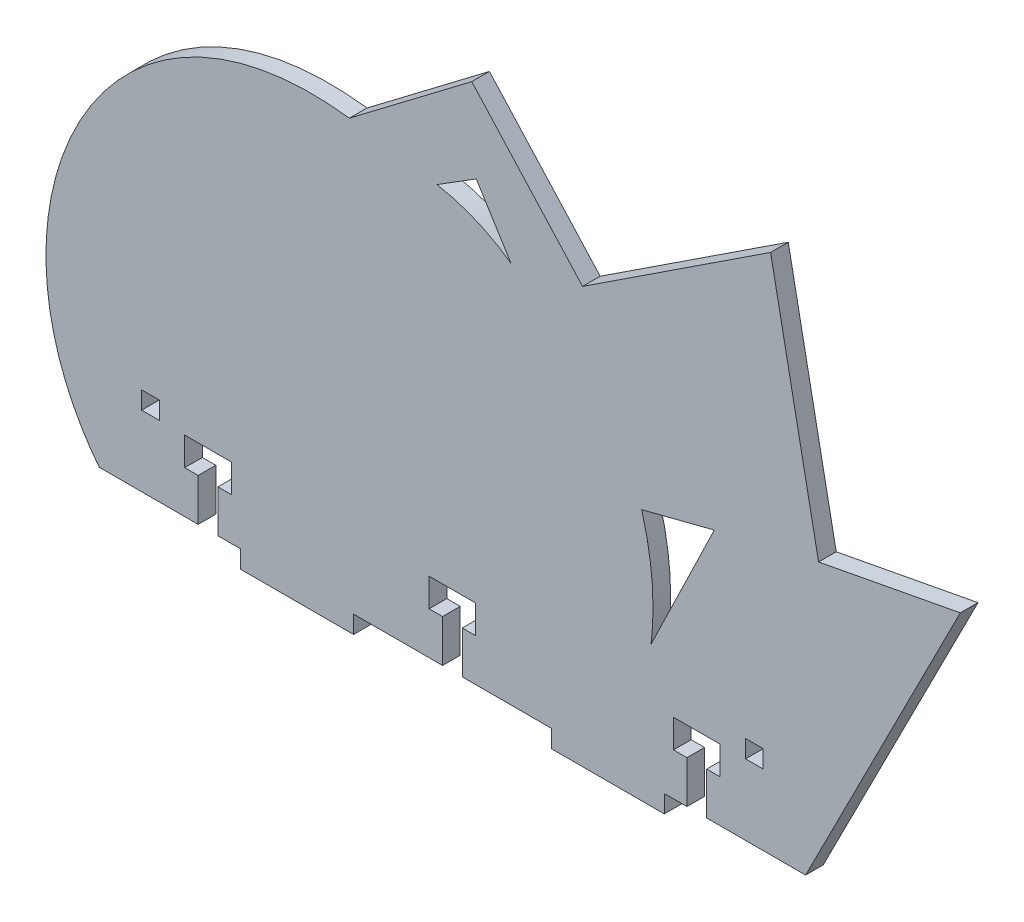
from build123d import *

# Parameters (mm, degrees)
BOSS_EXTRUDE2_DEPTH = 6.35
SCALE1_DEPTH        = 6.35
SCALE1_2_DEPTH      = 1.587500269
SCALE1_START        = 4.762500269
SCALE1_3_DEPTH      = 1.587499731
SCALE1_START_2      = 1.587500269
SCALE1_4_DEPTH      = 3.175
SKETCH2_W           = 3.175
SKETCH2_H           = 3.175
CUT_EXTRUDE2_DEPTH  = 3.175
SKETCH3_W           = 20.32
SKETCH3_H           = 3.175
BOSS_EXTRUDE3_DEPTH = 3.175
CUT_EXTRUDE3_DEPTH  = 3.175


# Read off the part's stored shape, not the designer's step: Scale1
with BuildPart() as part:
    # Sketch1 → Boss-Extrude2 (new body)
    with BuildSketch(Plane.XY):
        with BuildLine():
            Line((83.827808052, -44.105116896), (-89.955824252, -44.105116896))
            add(Edge.make_bspline(
                [(-89.955824252, -44.105116896), (-138.279146298, 17.577773588), (-90.448185334, 121.033367978), (0, 109.592549188)],
                knots=[0, 0, 0, 0, 1, 1, 1, 1], degree=3))
            Line((0, 109.592549188), (44.001127073, 142.976601592))
            Line((44.001127073, 142.976601592), (83.827808052, 99.113432677))
            Line((83.827808052, 99.113432677), (151.46035168, 143.51342315))
            Line((151.46035168, 143.51342315), (168.705700605, 55.742873106))
            Line((168.705700605, 55.742873106), (219.688100022, 65.389167163))
            Line((219.688100022, 65.389167163), (164.044175748, -44.105116896))
            Line((164.044175748, -44.105116896), (83.827808052, -44.105116896))
        make_face()
        with BuildLine():
            Line((108.479325939, 0.038399309), (131.217832103, 46.925099923))
            Line((131.217832103, 46.925099923), (105.101551368, 40.233461811))
            add(Edge.make_bspline(
                [(108.479325939, 0.038399309), (109.348375822, 7.243418902), (109.431703621, 20.845994783), (106.837891987, 34.226883905), (105.101551368, 40.233461811)],
                knots=[0.221169561, 0.221169561, 0.221169561, 0.221169561, 0.320684156, 0.405876818, 0.405876818, 0.405876818, 0.405876818], degree=3))
        make_face(mode=Mode.SUBTRACT)
        with BuildLine():
            Line((31.501577026, 104.663344036), (45.60523641, 113.478131151))
            Line((45.60523641, 113.478131151), (58.141193688, 93.420599506))
            add(Edge.make_bspline(
                [(58.141193688, 93.420599506), (46.052907541, 102.061530026), (31.501577026, 104.663344036)],
                knots=[0, 0, 0, 1, 1, 1], degree=2))
        make_face(mode=Mode.SUBTRACT)
    extrude(amount=BOSS_EXTRUDE2_DEPTH)

    # Scale1 outline → Scale1 (cut)
    # profile 1 of 3: a face of its own
    with BuildSketch(Plane.XY):
        with BuildLine():
            Line((44.001127073, 142.976601592), (0, 109.592549188))
            add(Edge.make_bspline(
                [(0, 109.592549188), (-90.448185334, 121.033367978), (-138.279146298, 17.577773588), (-89.955824252, -44.105116896)],
                knots=[0, 0, 0, 0, 1, 1, 1, 1], degree=3))
            Line((-89.955824252, -44.105116896), (164.044175748, -44.105116896))
            Line((164.044175748, -44.105116896), (219.688100022, 65.389167163))
            Line((219.688100022, 65.389167163), (168.705700605, 55.742873106))
            Line((168.705700605, 55.742873106), (151.46035168, 143.51342315))
            Line((151.46035168, 143.51342315), (83.827808052, 99.113432677))
            Line((83.827808052, 99.113432677), (44.001127073, 142.976601592))
        make_face()
        with BuildLine():
            add(Edge.make_bspline(
                [(22.378427384, 71.952774895), (-22.845665283, 77.67318429), (-46.761145765, 25.945387095), (-22.599484742, -4.896058147)],
                knots=[0, 0, 0, 0, 1, 1, 1, 1], degree=3))
            Line((22.378427384, 71.952774895), (44.378990921, 88.644801097))
            Line((44.378990921, 88.644801097), (64.29233141, 66.713216639))
            Line((64.29233141, 66.713216639), (98.108603224, 88.913211876))
            Line((98.108603224, 88.913211876), (106.731277687, 45.027936854))
            Line((106.731277687, 45.027936854), (132.222477396, 49.851083882))
            Line((132.222477396, 49.851083882), (130.663317047, 46.783019429))
            Line((130.663317047, 46.783019429), (131.217832103, 46.925099923))
            Line((131.217832103, 46.925099923), (108.479325939, 0.038399309))
            add(Edge.make_bspline(
                [(108.864671926, 3.888362517), (108.762049288, 2.601843236), (108.633688525, 1.318171025), (108.479325939, 0.038399309)],
                knots=[0.388200813, 0.388200813, 0.388200813, 0.388200813, 0.405876818, 0.405876818, 0.405876818, 0.405876818], degree=3))
            Line((108.864671926, 3.888362517), (104.400515258, -4.896058147))
            Line((104.400515258, -4.896058147), (-22.599484742, -4.896058147))
        make_face(mode=Mode.SUBTRACT)
        with BuildLine():
            add(Edge.make_bspline(
                [(31.501577026, 104.663344036), (46.052907541, 102.061530026), (58.141193688, 93.420599506)],
                knots=[0, 0, 0, 1, 1, 1], degree=2))
            Line((31.501577026, 104.663344036), (45.60523641, 113.478131151))
            Line((45.60523641, 113.478131151), (58.141193688, 93.420599506))
        make_face(mode=Mode.SUBTRACT)
    # profile 2 of 3: a face of its own
    with BuildSketch(Plane.XY):
        with BuildLine():
            Line((45.18104559, 73.895565876), (38.129215897, 69.488172319))
            add(Edge.make_bspline(
                [(38.129215897, 69.488172319), (45.404881155, 68.187265314), (51.449024229, 63.866800054)],
                knots=[0, 0, 0, 1, 1, 1], degree=2))
            Line((51.449024229, 63.866800054), (45.18104559, 73.895565876))
        make_face()
    # profile 3 of 3: a face of its own
    with BuildSketch(Plane.XY):
        with BuildLine():
            Line((87.987343436, 40.619050262), (74.929203069, 37.273231206))
            add(Edge.make_bspline(
                [(74.929203069, 37.273231206), (75.797373378, 34.269942253), (77.094279195, 27.579497692), (77.052615295, 20.778209752), (76.618090354, 17.175699955)],
                knots=[0.221169561, 0.221169561, 0.221169561, 0.221169561, 0.306362223, 0.405876818, 0.405876818, 0.405876818, 0.405876818], degree=3))
            Line((76.618090354, 17.175699955), (87.987343436, 40.619050262))
        make_face()
    extrude(amount=SCALE1_DEPTH, mode=Mode.SUBTRACT)

    # Scale1 2 outline → Scale1 2 (cut)
    with BuildSketch(Plane.XY):
        with BuildLine():
            Line((44.378990921, 88.644801097), (22.378427384, 71.952774895))
            add(Edge.make_bspline(
                [(22.378427384, 71.952774895), (-22.845665283, 77.67318429), (-46.761145765, 25.945387095), (-22.599484742, -4.896058147)],
                knots=[0, 0, 0, 0, 1, 1, 1, 1], degree=3))
            Line((-22.599484742, -4.896058147), (104.400515258, -4.896058147))
            Line((104.400515258, -4.896058147), (108.864671926, 3.888362517))
            add(Edge.make_bspline(
                [(105.101551368, 40.233461811), (106.837891987, 34.226883905), (109.183482579, 22.126511148), (109.339807105, 9.844851123), (108.864671926, 3.888362517)],
                knots=[0.221169561, 0.221169561, 0.221169561, 0.221169561, 0.306362223, 0.388200813, 0.388200813, 0.388200813, 0.388200813], degree=3))
            Line((105.101551368, 40.233461811), (130.663317047, 46.783019429))
            Line((130.663317047, 46.783019429), (132.222477396, 49.851083882))
            Line((132.222477396, 49.851083882), (106.731277687, 45.027936854))
            Line((106.731277687, 45.027936854), (98.108603224, 88.913211876))
            Line((98.108603224, 88.913211876), (64.29233141, 66.713216639))
            Line((64.29233141, 66.713216639), (44.378990921, 88.644801097))
        make_face()
        with BuildLine():
            add(Edge.make_bspline(
                [(74.929203069, 37.273231206), (75.797373378, 34.269942253), (77.094279195, 27.579497692), (77.052615295, 20.778209752), (76.618090354, 17.175699955)],
                knots=[0.221169561, 0.221169561, 0.221169561, 0.221169561, 0.306362223, 0.405876818, 0.405876818, 0.405876818, 0.405876818], degree=3))
            Line((74.929203069, 37.273231206), (87.987343436, 40.619050262))
            Line((87.987343436, 40.619050262), (76.618090354, 17.175699955))
        make_face(mode=Mode.SUBTRACT)
        with BuildLine():
            add(Edge.make_bspline(
                [(38.129215897, 69.488172319), (45.404881155, 68.187265314), (51.449024229, 63.866800054)],
                knots=[0, 0, 0, 1, 1, 1], degree=2))
            Line((38.129215897, 69.488172319), (45.18104559, 73.895565876))
            Line((45.18104559, 73.895565876), (51.449024229, 63.866800054))
        make_face(mode=Mode.SUBTRACT)
    extrude(amount=SCALE1_2_DEPTH, mode=Mode.SUBTRACT)

    # Scale1 3 outline → Scale1 3 (cut)
    with BuildSketch(Plane.XY.offset(SCALE1_START)):
        with BuildLine():
            Line((44.378990921, 88.644801097), (22.378427384, 71.952774895))
            add(Edge.make_bspline(
                [(22.378427384, 71.952774895), (-22.845665283, 77.67318429), (-46.761145765, 25.945387095), (-22.599484742, -4.896058147)],
                knots=[0, 0, 0, 0, 1, 1, 1, 1], degree=3))
            Line((-22.599484742, -4.896058147), (104.400515258, -4.896058147))
            Line((104.400515258, -4.896058147), (108.864671926, 3.888362517))
            add(Edge.make_bspline(
                [(105.101551368, 40.233461811), (106.837891987, 34.226883905), (109.183482579, 22.126511148), (109.339807105, 9.844851123), (108.864671926, 3.888362517)],
                knots=[0.221169561, 0.221169561, 0.221169561, 0.221169561, 0.306362223, 0.388200813, 0.388200813, 0.388200813, 0.388200813], degree=3))
            Line((105.101551368, 40.233461811), (130.663317047, 46.783019429))
            Line((130.663317047, 46.783019429), (132.222477396, 49.851083882))
            Line((132.222477396, 49.851083882), (106.731277687, 45.027936854))
            Line((106.731277687, 45.027936854), (98.108603224, 88.913211876))
            Line((98.108603224, 88.913211876), (64.29233141, 66.713216639))
            Line((64.29233141, 66.713216639), (44.378990921, 88.644801097))
        make_face()
        with BuildLine():
            add(Edge.make_bspline(
                [(74.929203069, 37.273231206), (75.797373378, 34.269942253), (77.094279195, 27.579497692), (77.052615295, 20.778209752), (76.618090354, 17.175699955)],
                knots=[0.221169561, 0.221169561, 0.221169561, 0.221169561, 0.306362223, 0.405876818, 0.405876818, 0.405876818, 0.405876818], degree=3))
            Line((74.929203069, 37.273231206), (87.987343436, 40.619050262))
            Line((87.987343436, 40.619050262), (76.618090354, 17.175699955))
        make_face(mode=Mode.SUBTRACT)
        with BuildLine():
            add(Edge.make_bspline(
                [(38.129215897, 69.488172319), (45.404881155, 68.187265314), (51.449024229, 63.866800054)],
                knots=[0, 0, 0, 1, 1, 1], degree=2))
            Line((38.129215897, 69.488172319), (45.18104559, 73.895565876))
            Line((45.18104559, 73.895565876), (51.449024229, 63.866800054))
        make_face(mode=Mode.SUBTRACT)
    extrude(amount=SCALE1_3_DEPTH, mode=Mode.SUBTRACT)

    # Scale1 4 outline → Scale1 4 (add)
    with BuildSketch(Plane.XY.offset(SCALE1_START_2)):
        with BuildLine():
            add(Edge.make_bspline(
                [(105.101551368, 40.233461811), (106.837891987, 34.226883905), (109.183482579, 22.126511148), (109.339807105, 9.844851123), (108.864671926, 3.888362517)],
                knots=[0.221169561, 0.221169561, 0.221169561, 0.221169561, 0.306362223, 0.388200813, 0.388200813, 0.388200813, 0.388200813], degree=3))
            Line((108.864671926, 3.888362517), (130.663317047, 46.783019429))
            Line((130.663317047, 46.783019429), (105.101551368, 40.233461811))
        make_face()
    extrude(amount=SCALE1_4_DEPTH)

    # Sketch2 → Cut-Extrude2 (cut)
    with BuildSketch(Plane.XY.offset(4.762500269)):
        with Locations((-13.391984742, 9.391441853)):
            Rectangle(SKETCH2_W, SKETCH2_H)
        with Locations((95.193015258, 9.391441853)):
            Rectangle(SKETCH2_W, SKETCH2_H)
    extrude(amount=-CUT_EXTRUDE2_DEPTH, mode=Mode.SUBTRACT)

    # Sketch3 → Boss-Extrude3 (add)
    with BuildSketch(Plane.XZ.offset(4.896058147)):
        with Locations((12.960515258, 3.175000269)):
            Rectangle(SKETCH3_W, SKETCH3_H)
        with Locations((68.840515258, 3.175000269)):
            Rectangle(SKETCH3_W, SKETCH3_H)
    extrude(amount=BOSS_EXTRUDE3_DEPTH)

    # Sketch4 → Cut-Extrude3 (cut)
    with BuildSketch(Plane.XY.offset(4.762500269)):
        Polygon((-7.232484742, 7.803941853), (1.149515258, 7.803941853), (1.149515258, 2.723941853), (-1.263484742, 2.723941853), (-1.263484742, -4.896058147), (-4.819484742, -4.896058147), (-4.819484742, 2.723941853), (-7.232484742, 2.723941853), align=None)
        Polygon((36.709515258, 7.803941853), (45.091515258, 7.803941853), (45.091515258, 2.723941853), (42.678515258, 2.723941853), (42.678515258, -4.896058147), (39.122515258, -4.896058147), (39.122515258, 2.723941853), (36.709515258, 2.723941853), align=None)
        Polygon((80.651515258, 7.803941853), (89.033515258, 7.803941853), (89.033515258, 2.723941853), (86.620515258, 2.723941853), (86.620515258, -4.896058147), (83.064515258, -4.896058147), (83.064515258, 2.723941853), (80.651515258, 2.723941853), align=None)
    extrude(amount=-CUT_EXTRUDE3_DEPTH, mode=Mode.SUBTRACT)


solid = part.part
